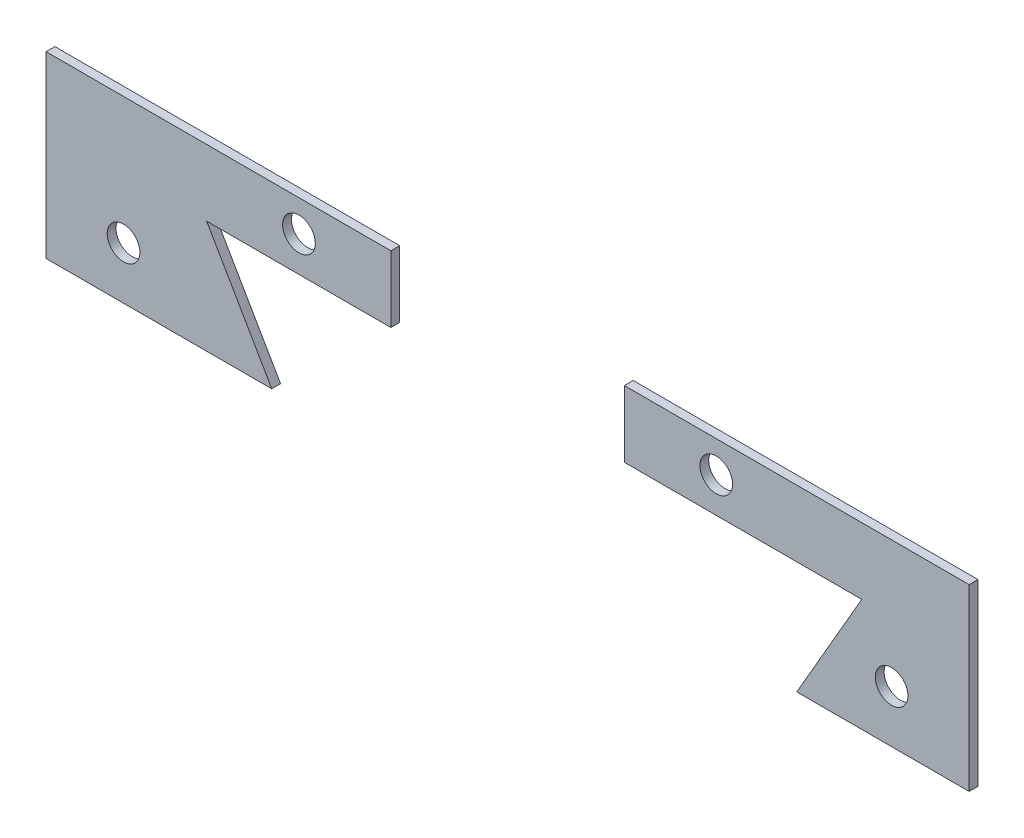
from build123d import *

# Parameters (mm, degrees)
BOSS_EXTRUDE1_DEPTH            = 1.21412
BOSS_EXTRUDE1_2_DEPTH          = 1.21412
SKETCH3_W                      = 2.2479
SKETCH3_H                      = 1.21412
F_8_CLEARANCE_HOLE1_AT_2_COUNT = 2
F_8_CLEARANCE_HOLE1_AT_2_PITCH = 27.477896212
F_8_CLEARANCE_HOLE1_AT_3_COUNT = 2
F_8_CLEARANCE_HOLE1_AT_3_PITCH = 57.404
F_8_CLEARANCE_HOLE1_AT_4_COUNT = 2
F_8_CLEARANCE_HOLE1_AT_4_PITCH = 82.586748551


with BuildPart() as part:
    # Sketch1 → Boss-Extrude1 (new body)
    with BuildSketch(Plane.XY):
        Polygon((-63.5, 0.762), (-32.447038773, 0.762), (-41.392503844, 16.256), (-16.056336319, 16.256), (-16.056336319, 25.4), (-63.5, 25.4), align=None)
    extrude(amount=BOSS_EXTRUDE1_DEPTH)

    # Sketch3 → #8 Clearance Hole1 (revolve, cut)
    with BuildSketch(Plane(origin=(-28.702, 21.082, 1.21412), x_dir=(0, -1, 0), z_dir=(1, 0, 0))):
        with Locations((1.12395, 0.60706)):
            Rectangle(SKETCH3_W, SKETCH3_H)
    f_8_clearance_hole1 = revolve(axis=Axis((-28.702, 21.082, 7.56412), (0, 0, -1)), mode=Mode.SUBTRACT)

    # #8 Clearance Hole1 at 2: #8 Clearance Hole1 ×2
    with Locations(*[Vector(-0.878160388030778, -0.47836631663781826, 0) * (i * F_8_CLEARANCE_HOLE1_AT_2_PITCH) for i in range(1, F_8_CLEARANCE_HOLE1_AT_2_COUNT)]):
        add(f_8_clearance_hole1, mode=Mode.SUBTRACT)


with BuildPart() as body_2:
    # Sketch1 → Boss-Extrude1 2 (new body)
    with BuildSketch(Plane.XY):
        Polygon((16.056336319, 16.256), (48.724852263, 16.256), (39.779387192, 0.762), (63.5, 0.762), (63.5, 25.4), (16.056336319, 25.4), align=None)
    extrude(amount=BOSS_EXTRUDE1_2_DEPTH)

    # #8 Clearance Hole1 at 3: #8 Clearance Hole1 ×2
    with Locations(*[(i * F_8_CLEARANCE_HOLE1_AT_3_PITCH, 0, 0) for i in range(1, F_8_CLEARANCE_HOLE1_AT_3_COUNT)]):
        add(f_8_clearance_hole1, mode=Mode.SUBTRACT)

    # #8 Clearance Hole1 at 4: #8 Clearance Hole1 ×2
    with Locations(*[Vector(0.9872528151354362, -0.15915991645875022, 0) * (i * F_8_CLEARANCE_HOLE1_AT_4_PITCH) for i in range(1, F_8_CLEARANCE_HOLE1_AT_4_COUNT)]):
        add(f_8_clearance_hole1, mode=Mode.SUBTRACT)


solid = Compound([part.part, body_2.part])
